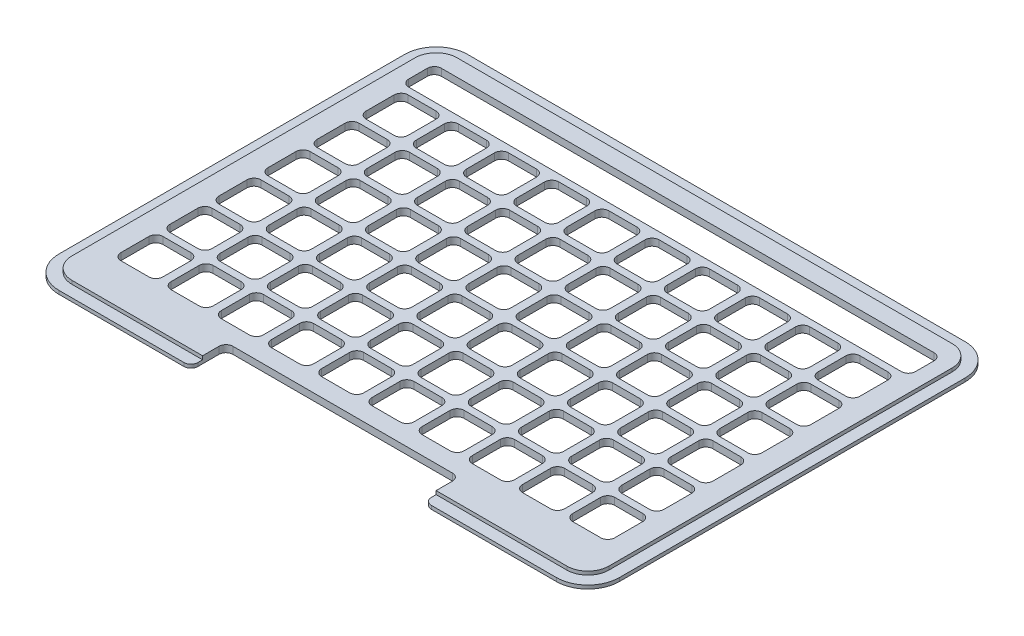
from build123d import *

# Parameters (mm, degrees)
SKETCH1_W                = 240
SKETCH1_H                = 175
OUTER_PROFILE_DEPTH      = 1.5
SKETCH2_W                = 230
SKETCH2_H                = 165
INNER_PROFILE_DEPTH      = 1.5
FILLET1_R                = 9
FILLET2_R                = 13.5
SKETCH3_W                = 18
SKETCH3_H                = 18
CUTOUT_DEPTH             = 149.543764595
CORNERS_R                = 3
CUTOUTS_COUNT            = 5
CUTOUTS_PITCH            = 21.5
CUTOUTS_COUNT_DIR2       = 6
CUTOUTS_PITCH_DIR2       = 21
CORNERS_OF_CUTOUTS_R     = 3
MIRROR1_DEPTH            = 3
SKETCH4_W                = 217
SKETCH4_H                = 14
MESSAGE_WINDOW_DEPTH     = 149.543764595
MESSAGE_WINDOW_CORNERS_R = 3
SKETCH6_W                = 100
SKETCH6_H                = 15
BASE_CUTBACK_DEPTH       = 149.543764595
FILLET5_R                = 3


# Read off the part's stored shape, not the designer's step: Mirror1
with BuildPart() as part:
    # Sketch1 → Outer Profile (new body)
    with BuildSketch(Plane(origin=(0, 0, 0), x_dir=(1, 0, 0), z_dir=(0, 1, 0))):
        Rectangle(SKETCH1_W, SKETCH1_H)
    extrude(amount=OUTER_PROFILE_DEPTH)

    # Sketch2 → Inner Profile (add)
    with BuildSketch(Plane(origin=(0, 1.5, 0), x_dir=(1, 0, 0), z_dir=(0, 1, 0))):
        Rectangle(SKETCH2_W, SKETCH2_H)
    extrude(amount=INNER_PROFILE_DEPTH)

    # Fillet1
    fillet1_edges = [part.edges().sort_by_distance(p)[0] for p in [
        (115, 2.25, 82.5),
        (115, 2.25, -82.5),
        (-115, 2.25, -82.5),
        (-115, 2.25, 82.5),
    ]]
    fillet(fillet1_edges, radius=FILLET1_R)

    # Fillet2
    fillet2_edges = [part.edges().sort_by_distance(p)[0] for p in [
        (120, 0.75, 87.5),
        (-120, 0.75, 87.5),
        (-120, 0.75, -87.5),
        (120, 0.75, -87.5),
    ]]
    fillet(fillet2_edges, radius=FILLET2_R)

    # Sketch3 → Cutout (cut, through all)
    with BuildSketch(Plane(origin=(0, 3, 0), x_dir=(1, 0, 0), z_dir=(0, 1, 0))):
        with Locations((-10.75, -55.75)):
            Rectangle(SKETCH3_W, SKETCH3_H)
    cutout = extrude(amount=-CUTOUT_DEPTH, mode=Mode.SUBTRACT)

    # Corners
    corners_edges = [part.edges().sort_by_distance(p)[0] for p in [
        (-1.75, 1.5, 46.75),
        (-1.75, 1.5, 64.75),
        (-19.75, 1.5, 64.75),
        (-19.75, 1.5, 46.75),
    ]]
    fillet(corners_edges, radius=CORNERS_R)

    # Cutouts: Cutout 5 × 6
    with Locations(*[(-i * CUTOUTS_PITCH, 0, -j * CUTOUTS_PITCH_DIR2) for i in range(CUTOUTS_COUNT) for j in range(CUTOUTS_COUNT_DIR2) if (i, j) != (0, 0)]):
        add(cutout, mode=Mode.SUBTRACT)

    # Corners of Cutouts
    corners_of_cutouts_edges = [part.edges().sort_by_distance(p)[0] for p in [
        (-1.75, 1.5, 25.75),
        (-1.75, 1.5, 43.75),
        (-19.75, 1.5, 43.75),
        (-19.75, 1.5, 25.75),
        (-1.75, 1.5, 4.75),
        (-1.75, 1.5, 22.75),
        (-19.75, 1.5, 22.75),
        (-19.75, 1.5, 4.75),
        (-1.75, 1.5, -16.25),
        (-1.75, 1.5, 1.75),
        (-19.75, 1.5, 1.75),
        (-19.75, 1.5, -16.25),
        (-1.75, 1.5, -37.25),
        (-1.75, 1.5, -19.25),
        (-19.75, 1.5, -19.25),
        (-19.75, 1.5, -37.25),
        (-1.75, 1.5, -58.25),
        (-1.75, 1.5, -40.25),
        (-19.75, 1.5, -40.25),
        (-19.75, 1.5, -58.25),
        (-23.25, 1.5, 46.75),
        (-23.25, 1.5, 64.75),
        (-41.25, 1.5, 64.75),
        (-41.25, 1.5, 46.75),
        (-23.25, 1.5, 25.75),
        (-23.25, 1.5, 43.75),
        (-41.25, 1.5, 43.75),
        (-41.25, 1.5, 25.75),
        (-23.25, 1.5, 4.75),
        (-23.25, 1.5, 22.75),
        (-41.25, 1.5, 22.75),
        (-41.25, 1.5, 4.75),
        (-23.25, 1.5, -16.25),
        (-23.25, 1.5, 1.75),
        (-41.25, 1.5, 1.75),
        (-41.25, 1.5, -16.25),
        (-23.25, 1.5, -37.25),
        (-23.25, 1.5, -19.25),
        (-41.25, 1.5, -19.25),
        (-41.25, 1.5, -37.25),
        (-23.25, 1.5, -58.25),
        (-23.25, 1.5, -40.25),
        (-41.25, 1.5, -40.25),
        (-41.25, 1.5, -58.25),
        (-44.75, 1.5, 46.75),
        (-44.75, 1.5, 64.75),
        (-62.75, 1.5, 64.75),
        (-62.75, 1.5, 46.75),
        (-44.75, 1.5, 25.75),
        (-44.75, 1.5, 43.75),
        (-62.75, 1.5, 43.75),
        (-62.75, 1.5, 25.75),
        (-44.75, 1.5, 4.75),
        (-44.75, 1.5, 22.75),
        (-62.75, 1.5, 22.75),
        (-62.75, 1.5, 4.75),
        (-44.75, 1.5, -16.25),
        (-44.75, 1.5, 1.75),
        (-62.75, 1.5, 1.75),
        (-62.75, 1.5, -16.25),
        (-44.75, 1.5, -37.25),
        (-44.75, 1.5, -19.25),
        (-62.75, 1.5, -19.25),
        (-62.75, 1.5, -37.25),
        (-44.75, 1.5, -58.25),
        (-44.75, 1.5, -40.25),
        (-62.75, 1.5, -40.25),
        (-62.75, 1.5, -58.25),
        (-66.25, 1.5, 46.75),
        (-66.25, 1.5, 64.75),
        (-84.25, 1.5, 64.75),
        (-84.25, 1.5, 46.75),
        (-66.25, 1.5, 25.75),
        (-66.25, 1.5, 43.75),
        (-84.25, 1.5, 43.75),
        (-84.25, 1.5, 25.75),
        (-66.25, 1.5, 4.75),
        (-66.25, 1.5, 22.75),
        (-84.25, 1.5, 22.75),
        (-84.25, 1.5, 4.75),
        (-66.25, 1.5, -16.25),
        (-66.25, 1.5, 1.75),
        (-84.25, 1.5, 1.75),
        (-84.25, 1.5, -16.25),
        (-66.25, 1.5, -37.25),
        (-66.25, 1.5, -19.25),
        (-84.25, 1.5, -19.25),
        (-84.25, 1.5, -37.25),
        (-66.25, 1.5, -58.25),
        (-66.25, 1.5, -40.25),
        (-84.25, 1.5, -40.25),
        (-84.25, 1.5, -58.25),
        (-87.75, 1.5, 46.75),
        (-87.75, 1.5, 64.75),
        (-105.75, 1.5, 64.75),
        (-105.75, 1.5, 46.75),
        (-87.75, 1.5, 25.75),
        (-87.75, 1.5, 43.75),
        (-105.75, 1.5, 43.75),
        (-105.75, 1.5, 25.75),
        (-87.75, 1.5, 4.75),
        (-87.75, 1.5, 22.75),
        (-105.75, 1.5, 22.75),
        (-105.75, 1.5, 4.75),
        (-87.75, 1.5, -16.25),
        (-87.75, 1.5, 1.75),
        (-105.75, 1.5, 1.75),
        (-105.75, 1.5, -16.25),
        (-87.75, 1.5, -37.25),
        (-87.75, 1.5, -19.25),
        (-105.75, 1.5, -19.25),
        (-105.75, 1.5, -37.25),
        (-87.75, 1.5, -58.25),
        (-87.75, 1.5, -40.25),
        (-105.75, 1.5, -40.25),
        (-105.75, 1.5, -58.25),
    ]]
    fillet(corners_of_cutouts_edges, radius=CORNERS_OF_CUTOUTS_R)

    # Mirror1 outline → Mirror1 (cut)
    with BuildSketch(Plane(origin=(0, 0, 0), x_dir=(1, 0, 0), z_dir=(0, 1, 0))):
        with BuildLine():
            Line((4.75, -64.75), (16.75, -64.75))
            ThreePointArc((16.75, -64.75), (18.871320344, -63.871320344), (19.75, -61.75))
            Line((19.75, -61.75), (19.75, -49.75))
            ThreePointArc((19.75, -49.75), (18.871320344, -47.628679656), (16.75, -46.75))
            Line((16.75, -46.75), (4.75, -46.75))
            ThreePointArc((4.75, -46.75), (2.628679656, -47.628679656), (1.75, -49.75))
            Line((1.75, -49.75), (1.75, -61.75))
            ThreePointArc((1.75, -61.75), (2.628679656, -63.871320344), (4.75, -64.75))
        make_face()
        with BuildLine():
            Line((26.25, -64.75), (38.25, -64.75))
            ThreePointArc((38.25, -64.75), (40.371320344, -63.871320344), (41.25, -61.75))
            Line((41.25, -61.75), (41.25, -49.75))
            ThreePointArc((41.25, -49.75), (40.371320344, -47.628679656), (38.25, -46.75))
            Line((38.25, -46.75), (26.25, -46.75))
            ThreePointArc((26.25, -46.75), (24.128679656, -47.628679656), (23.25, -49.75))
            Line((23.25, -49.75), (23.25, -61.75))
            ThreePointArc((23.25, -61.75), (24.128679656, -63.871320344), (26.25, -64.75))
        make_face()
        with BuildLine():
            Line((47.75, -64.75), (59.75, -64.75))
            ThreePointArc((59.75, -64.75), (61.871320344, -63.871320344), (62.75, -61.75))
            Line((62.75, -61.75), (62.75, -49.75))
            ThreePointArc((62.75, -49.75), (61.871320344, -47.628679656), (59.75, -46.75))
            Line((59.75, -46.75), (47.75, -46.75))
            ThreePointArc((47.75, -46.75), (45.628679656, -47.628679656), (44.75, -49.75))
            Line((44.75, -49.75), (44.75, -61.75))
            ThreePointArc((44.75, -61.75), (45.628679656, -63.871320344), (47.75, -64.75))
        make_face()
        with BuildLine():
            Line((69.25, -64.75), (81.25, -64.75))
            ThreePointArc((81.25, -64.75), (83.371320344, -63.871320344), (84.25, -61.75))
            Line((84.25, -61.75), (84.25, -49.75))
            ThreePointArc((84.25, -49.75), (83.371320344, -47.628679656), (81.25, -46.75))
            Line((81.25, -46.75), (69.25, -46.75))
            ThreePointArc((69.25, -46.75), (67.128679656, -47.628679656), (66.25, -49.75))
            Line((66.25, -49.75), (66.25, -61.75))
            ThreePointArc((66.25, -61.75), (67.128679656, -63.871320344), (69.25, -64.75))
        make_face()
        with BuildLine():
            Line((90.75, -64.75), (102.75, -64.75))
            ThreePointArc((102.75, -64.75), (104.871320344, -63.871320344), (105.75, -61.75))
            Line((105.75, -61.75), (105.75, -49.75))
            ThreePointArc((105.75, -49.75), (104.871320344, -47.628679656), (102.75, -46.75))
            Line((102.75, -46.75), (90.75, -46.75))
            ThreePointArc((90.75, -46.75), (88.628679656, -47.628679656), (87.75, -49.75))
            Line((87.75, -49.75), (87.75, -61.75))
            ThreePointArc((87.75, -61.75), (88.628679656, -63.871320344), (90.75, -64.75))
        make_face()
        with BuildLine():
            Line((4.75, -43.75), (16.75, -43.75))
            ThreePointArc((16.75, -43.75), (18.871320344, -42.871320344), (19.75, -40.75))
            Line((19.75, -40.75), (19.75, -28.75))
            ThreePointArc((19.75, -28.75), (18.871320344, -26.628679656), (16.75, -25.75))
            Line((16.75, -25.75), (4.75, -25.75))
            ThreePointArc((4.75, -25.75), (2.628679656, -26.628679656), (1.75, -28.75))
            Line((1.75, -28.75), (1.75, -40.75))
            ThreePointArc((1.75, -40.75), (2.628679656, -42.871320344), (4.75, -43.75))
        make_face()
        with BuildLine():
            Line((26.25, -43.75), (38.25, -43.75))
            ThreePointArc((38.25, -43.75), (40.371320344, -42.871320344), (41.25, -40.75))
            Line((41.25, -40.75), (41.25, -28.75))
            ThreePointArc((41.25, -28.75), (40.371320344, -26.628679656), (38.25, -25.75))
            Line((38.25, -25.75), (26.25, -25.75))
            ThreePointArc((26.25, -25.75), (24.128679656, -26.628679656), (23.25, -28.75))
            Line((23.25, -28.75), (23.25, -40.75))
            ThreePointArc((23.25, -40.75), (24.128679656, -42.871320344), (26.25, -43.75))
        make_face()
        with BuildLine():
            Line((47.75, -43.75), (59.75, -43.75))
            ThreePointArc((59.75, -43.75), (61.871320344, -42.871320344), (62.75, -40.75))
            Line((62.75, -40.75), (62.75, -28.75))
            ThreePointArc((62.75, -28.75), (61.871320344, -26.628679656), (59.75, -25.75))
            Line((59.75, -25.75), (47.75, -25.75))
            ThreePointArc((47.75, -25.75), (45.628679656, -26.628679656), (44.75, -28.75))
            Line((44.75, -28.75), (44.75, -40.75))
            ThreePointArc((44.75, -40.75), (45.628679656, -42.871320344), (47.75, -43.75))
        make_face()
        with BuildLine():
            Line((69.25, -43.75), (81.25, -43.75))
            ThreePointArc((81.25, -43.75), (83.371320344, -42.871320344), (84.25, -40.75))
            Line((84.25, -40.75), (84.25, -28.75))
            ThreePointArc((84.25, -28.75), (83.371320344, -26.628679656), (81.25, -25.75))
            Line((81.25, -25.75), (69.25, -25.75))
            ThreePointArc((69.25, -25.75), (67.128679656, -26.628679656), (66.25, -28.75))
            Line((66.25, -28.75), (66.25, -40.75))
            ThreePointArc((66.25, -40.75), (67.128679656, -42.871320344), (69.25, -43.75))
        make_face()
        with BuildLine():
            Line((90.75, -43.75), (102.75, -43.75))
            ThreePointArc((102.75, -43.75), (104.871320344, -42.871320344), (105.75, -40.75))
            Line((105.75, -40.75), (105.75, -28.75))
            ThreePointArc((105.75, -28.75), (104.871320344, -26.628679656), (102.75, -25.75))
            Line((102.75, -25.75), (90.75, -25.75))
            ThreePointArc((90.75, -25.75), (88.628679656, -26.628679656), (87.75, -28.75))
            Line((87.75, -28.75), (87.75, -40.75))
            ThreePointArc((87.75, -40.75), (88.628679656, -42.871320344), (90.75, -43.75))
        make_face()
        with BuildLine():
            Line((4.75, -22.75), (16.75, -22.75))
            ThreePointArc((16.75, -22.75), (18.871320344, -21.871320344), (19.75, -19.75))
            Line((19.75, -19.75), (19.75, -7.75))
            ThreePointArc((19.75, -7.75), (18.871320344, -5.628679656), (16.75, -4.75))
            Line((16.75, -4.75), (4.75, -4.75))
            ThreePointArc((4.75, -4.75), (2.628679656, -5.628679656), (1.75, -7.75))
            Line((1.75, -7.75), (1.75, -19.75))
            ThreePointArc((1.75, -19.75), (2.628679656, -21.871320344), (4.75, -22.75))
        make_face()
        with BuildLine():
            Line((26.25, -22.75), (38.25, -22.75))
            ThreePointArc((38.25, -22.75), (40.371320344, -21.871320344), (41.25, -19.75))
            Line((41.25, -19.75), (41.25, -7.75))
            ThreePointArc((41.25, -7.75), (40.371320344, -5.628679656), (38.25, -4.75))
            Line((38.25, -4.75), (26.25, -4.75))
            ThreePointArc((26.25, -4.75), (24.128679656, -5.628679656), (23.25, -7.75))
            Line((23.25, -7.75), (23.25, -19.75))
            ThreePointArc((23.25, -19.75), (24.128679656, -21.871320344), (26.25, -22.75))
        make_face()
        with BuildLine():
            Line((47.75, -22.75), (59.75, -22.75))
            ThreePointArc((59.75, -22.75), (61.871320344, -21.871320344), (62.75, -19.75))
            Line((62.75, -19.75), (62.75, -7.75))
            ThreePointArc((62.75, -7.75), (61.871320344, -5.628679656), (59.75, -4.75))
            Line((59.75, -4.75), (47.75, -4.75))
            ThreePointArc((47.75, -4.75), (45.628679656, -5.628679656), (44.75, -7.75))
            Line((44.75, -7.75), (44.75, -19.75))
            ThreePointArc((44.75, -19.75), (45.628679656, -21.871320344), (47.75, -22.75))
        make_face()
        with BuildLine():
            Line((69.25, -22.75), (81.25, -22.75))
            ThreePointArc((81.25, -22.75), (83.371320344, -21.871320344), (84.25, -19.75))
            Line((84.25, -19.75), (84.25, -7.75))
            ThreePointArc((84.25, -7.75), (83.371320344, -5.628679656), (81.25, -4.75))
            Line((81.25, -4.75), (69.25, -4.75))
            ThreePointArc((69.25, -4.75), (67.128679656, -5.628679656), (66.25, -7.75))
            Line((66.25, -7.75), (66.25, -19.75))
            ThreePointArc((66.25, -19.75), (67.128679656, -21.871320344), (69.25, -22.75))
        make_face()
        with BuildLine():
            Line((90.75, -22.75), (102.75, -22.75))
            ThreePointArc((102.75, -22.75), (104.871320344, -21.871320344), (105.75, -19.75))
            Line((105.75, -19.75), (105.75, -7.75))
            ThreePointArc((105.75, -7.75), (104.871320344, -5.628679656), (102.75, -4.75))
            Line((102.75, -4.75), (90.75, -4.75))
            ThreePointArc((90.75, -4.75), (88.628679656, -5.628679656), (87.75, -7.75))
            Line((87.75, -7.75), (87.75, -19.75))
            ThreePointArc((87.75, -19.75), (88.628679656, -21.871320344), (90.75, -22.75))
        make_face()
        with BuildLine():
            Line((4.75, -1.75), (16.75, -1.75))
            ThreePointArc((16.75, -1.75), (18.871320344, -0.871320344), (19.75, 1.25))
            Line((19.75, 1.25), (19.75, 13.25))
            ThreePointArc((19.75, 13.25), (18.871320344, 15.371320344), (16.75, 16.25))
            Line((16.75, 16.25), (4.75, 16.25))
            ThreePointArc((4.75, 16.25), (2.628679656, 15.371320344), (1.75, 13.25))
            Line((1.75, 13.25), (1.75, 1.25))
            ThreePointArc((1.75, 1.25), (2.628679656, -0.871320344), (4.75, -1.75))
        make_face()
        with BuildLine():
            Line((26.25, -1.75), (38.25, -1.75))
            ThreePointArc((38.25, -1.75), (40.371320344, -0.871320344), (41.25, 1.25))
            Line((41.25, 1.25), (41.25, 13.25))
            ThreePointArc((41.25, 13.25), (40.371320344, 15.371320344), (38.25, 16.25))
            Line((38.25, 16.25), (26.25, 16.25))
            ThreePointArc((26.25, 16.25), (24.128679656, 15.371320344), (23.25, 13.25))
            Line((23.25, 13.25), (23.25, 1.25))
            ThreePointArc((23.25, 1.25), (24.128679656, -0.871320344), (26.25, -1.75))
        make_face()
        with BuildLine():
            Line((47.75, -1.75), (59.75, -1.75))
            ThreePointArc((59.75, -1.75), (61.871320344, -0.871320344), (62.75, 1.25))
            Line((62.75, 1.25), (62.75, 13.25))
            ThreePointArc((62.75, 13.25), (61.871320344, 15.371320344), (59.75, 16.25))
            Line((59.75, 16.25), (47.75, 16.25))
            ThreePointArc((47.75, 16.25), (45.628679656, 15.371320344), (44.75, 13.25))
            Line((44.75, 13.25), (44.75, 1.25))
            ThreePointArc((44.75, 1.25), (45.628679656, -0.871320344), (47.75, -1.75))
        make_face()
        with BuildLine():
            Line((69.25, -1.75), (81.25, -1.75))
            ThreePointArc((81.25, -1.75), (83.371320344, -0.871320344), (84.25, 1.25))
            Line((84.25, 1.25), (84.25, 13.25))
            ThreePointArc((84.25, 13.25), (83.371320344, 15.371320344), (81.25, 16.25))
            Line((81.25, 16.25), (69.25, 16.25))
            ThreePointArc((69.25, 16.25), (67.128679656, 15.371320344), (66.25, 13.25))
            Line((66.25, 13.25), (66.25, 1.25))
            ThreePointArc((66.25, 1.25), (67.128679656, -0.871320344), (69.25, -1.75))
        make_face()
        with BuildLine():
            Line((90.75, -1.75), (102.75, -1.75))
            ThreePointArc((102.75, -1.75), (104.871320344, -0.871320344), (105.75, 1.25))
            Line((105.75, 1.25), (105.75, 13.25))
            ThreePointArc((105.75, 13.25), (104.871320344, 15.371320344), (102.75, 16.25))
            Line((102.75, 16.25), (90.75, 16.25))
            ThreePointArc((90.75, 16.25), (88.628679656, 15.371320344), (87.75, 13.25))
            Line((87.75, 13.25), (87.75, 1.25))
            ThreePointArc((87.75, 1.25), (88.628679656, -0.871320344), (90.75, -1.75))
        make_face()
        with BuildLine():
            Line((4.75, 19.25), (16.75, 19.25))
            ThreePointArc((16.75, 19.25), (18.871320344, 20.128679656), (19.75, 22.25))
            Line((19.75, 22.25), (19.75, 34.25))
            ThreePointArc((19.75, 34.25), (18.871320344, 36.371320344), (16.75, 37.25))
            Line((16.75, 37.25), (4.75, 37.25))
            ThreePointArc((4.75, 37.25), (2.628679656, 36.371320344), (1.75, 34.25))
            Line((1.75, 34.25), (1.75, 22.25))
            ThreePointArc((1.75, 22.25), (2.628679656, 20.128679656), (4.75, 19.25))
        make_face()
        with BuildLine():
            Line((26.25, 19.25), (38.25, 19.25))
            ThreePointArc((38.25, 19.25), (40.371320344, 20.128679656), (41.25, 22.25))
            Line((41.25, 22.25), (41.25, 34.25))
            ThreePointArc((41.25, 34.25), (40.371320344, 36.371320344), (38.25, 37.25))
            Line((38.25, 37.25), (26.25, 37.25))
            ThreePointArc((26.25, 37.25), (24.128679656, 36.371320344), (23.25, 34.25))
            Line((23.25, 34.25), (23.25, 22.25))
            ThreePointArc((23.25, 22.25), (24.128679656, 20.128679656), (26.25, 19.25))
        make_face()
        with BuildLine():
            Line((47.75, 19.25), (59.75, 19.25))
            ThreePointArc((59.75, 19.25), (61.871320344, 20.128679656), (62.75, 22.25))
            Line((62.75, 22.25), (62.75, 34.25))
            ThreePointArc((62.75, 34.25), (61.871320344, 36.371320344), (59.75, 37.25))
            Line((59.75, 37.25), (47.75, 37.25))
            ThreePointArc((47.75, 37.25), (45.628679656, 36.371320344), (44.75, 34.25))
            Line((44.75, 34.25), (44.75, 22.25))
            ThreePointArc((44.75, 22.25), (45.628679656, 20.128679656), (47.75, 19.25))
        make_face()
        with BuildLine():
            Line((69.25, 19.25), (81.25, 19.25))
            ThreePointArc((81.25, 19.25), (83.371320344, 20.128679656), (84.25, 22.25))
            Line((84.25, 22.25), (84.25, 34.25))
            ThreePointArc((84.25, 34.25), (83.371320344, 36.371320344), (81.25, 37.25))
            Line((81.25, 37.25), (69.25, 37.25))
            ThreePointArc((69.25, 37.25), (67.128679656, 36.371320344), (66.25, 34.25))
            Line((66.25, 34.25), (66.25, 22.25))
            ThreePointArc((66.25, 22.25), (67.128679656, 20.128679656), (69.25, 19.25))
        make_face()
        with BuildLine():
            Line((90.75, 19.25), (102.75, 19.25))
            ThreePointArc((102.75, 19.25), (104.871320344, 20.128679656), (105.75, 22.25))
            Line((105.75, 22.25), (105.75, 34.25))
            ThreePointArc((105.75, 34.25), (104.871320344, 36.371320344), (102.75, 37.25))
            Line((102.75, 37.25), (90.75, 37.25))
            ThreePointArc((90.75, 37.25), (88.628679656, 36.371320344), (87.75, 34.25))
            Line((87.75, 34.25), (87.75, 22.25))
            ThreePointArc((87.75, 22.25), (88.628679656, 20.128679656), (90.75, 19.25))
        make_face()
        with BuildLine():
            Line((4.75, 40.25), (16.75, 40.25))
            ThreePointArc((16.75, 40.25), (18.871320344, 41.128679656), (19.75, 43.25))
            Line((19.75, 43.25), (19.75, 55.25))
            ThreePointArc((19.75, 55.25), (18.871320344, 57.371320344), (16.75, 58.25))
            Line((16.75, 58.25), (4.75, 58.25))
            ThreePointArc((4.75, 58.25), (2.628679656, 57.371320344), (1.75, 55.25))
            Line((1.75, 55.25), (1.75, 43.25))
            ThreePointArc((1.75, 43.25), (2.628679656, 41.128679656), (4.75, 40.25))
        make_face()
        with BuildLine():
            Line((26.25, 40.25), (38.25, 40.25))
            ThreePointArc((38.25, 40.25), (40.371320344, 41.128679656), (41.25, 43.25))
            Line((41.25, 43.25), (41.25, 55.25))
            ThreePointArc((41.25, 55.25), (40.371320344, 57.371320344), (38.25, 58.25))
            Line((38.25, 58.25), (26.25, 58.25))
            ThreePointArc((26.25, 58.25), (24.128679656, 57.371320344), (23.25, 55.25))
            Line((23.25, 55.25), (23.25, 43.25))
            ThreePointArc((23.25, 43.25), (24.128679656, 41.128679656), (26.25, 40.25))
        make_face()
        with BuildLine():
            Line((47.75, 40.25), (59.75, 40.25))
            ThreePointArc((59.75, 40.25), (61.871320344, 41.128679656), (62.75, 43.25))
            Line((62.75, 43.25), (62.75, 55.25))
            ThreePointArc((62.75, 55.25), (61.871320344, 57.371320344), (59.75, 58.25))
            Line((59.75, 58.25), (47.75, 58.25))
            ThreePointArc((47.75, 58.25), (45.628679656, 57.371320344), (44.75, 55.25))
            Line((44.75, 55.25), (44.75, 43.25))
            ThreePointArc((44.75, 43.25), (45.628679656, 41.128679656), (47.75, 40.25))
        make_face()
        with BuildLine():
            Line((69.25, 40.25), (81.25, 40.25))
            ThreePointArc((81.25, 40.25), (83.371320344, 41.128679656), (84.25, 43.25))
            Line((84.25, 43.25), (84.25, 55.25))
            ThreePointArc((84.25, 55.25), (83.371320344, 57.371320344), (81.25, 58.25))
            Line((81.25, 58.25), (69.25, 58.25))
            ThreePointArc((69.25, 58.25), (67.128679656, 57.371320344), (66.25, 55.25))
            Line((66.25, 55.25), (66.25, 43.25))
            ThreePointArc((66.25, 43.25), (67.128679656, 41.128679656), (69.25, 40.25))
        make_face()
        with BuildLine():
            Line((90.75, 40.25), (102.75, 40.25))
            ThreePointArc((102.75, 40.25), (104.871320344, 41.128679656), (105.75, 43.25))
            Line((105.75, 43.25), (105.75, 55.25))
            ThreePointArc((105.75, 55.25), (104.871320344, 57.371320344), (102.75, 58.25))
            Line((102.75, 58.25), (90.75, 58.25))
            ThreePointArc((90.75, 58.25), (88.628679656, 57.371320344), (87.75, 55.25))
            Line((87.75, 55.25), (87.75, 43.25))
            ThreePointArc((87.75, 43.25), (88.628679656, 41.128679656), (90.75, 40.25))
        make_face()
    extrude(amount=MIRROR1_DEPTH, mode=Mode.SUBTRACT)

    # Sketch4 → Message Window (cut, through all)
    with BuildSketch(Plane(origin=(0, 3, 0), x_dir=(1, 0, 0), z_dir=(0, 1, 0))):
        with Locations((0, 68.25)):
            Rectangle(SKETCH4_W, SKETCH4_H)
    extrude(amount=-MESSAGE_WINDOW_DEPTH, mode=Mode.SUBTRACT)

    # Message Window Corners
    message_window_corners_edges = [part.edges().sort_by_distance(p)[0] for p in [
        (-108.5, 1.5, -61.25),
        (-108.5, 1.5, -75.25),
        (108.5, 1.5, -75.25),
        (108.5, 1.5, -61.25),
    ]]
    fillet(message_window_corners_edges, radius=MESSAGE_WINDOW_CORNERS_R)

    # Sketch6 → Base Cutback (cut, through all)
    with BuildSketch(Plane(origin=(0, 3, 0), x_dir=(1, 0, 0), z_dir=(0, 1, 0))):
        with Locations((0, -80)):
            Rectangle(SKETCH6_W, SKETCH6_H)
    extrude(amount=-BASE_CUTBACK_DEPTH, mode=Mode.SUBTRACT)

    # Fillet5
    fillet5_edges = [part.edges().sort_by_distance(p)[0] for p in [
        (50, 0.75, 87.5),
        (50, 1.5, 72.5),
        (-50, 0.75, 87.5),
        (-50, 1.5, 72.5),
    ]]
    fillet(fillet5_edges, radius=FILLET5_R)


solid = part.part
